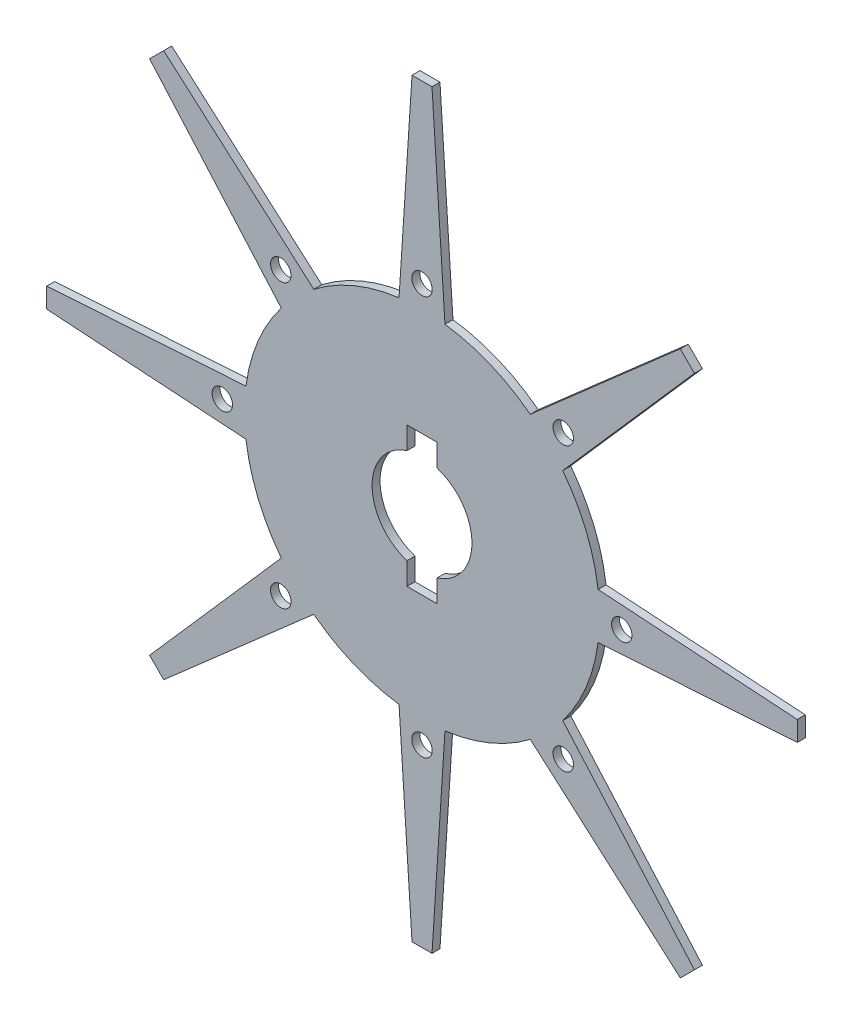
from build123d import *

# Parameters (mm, degrees)
BOSS_EXTRUDE1_DEPTH = 0.8
SKETCH2_R           = 1.025
CUT_EXTRUDE2_DEPTH  = 10


# Read off the part's stored shape, not the designer's step: Boss-Extrude1
with BuildPart() as part:
    # Boss-Extrude1 outline → Boss-Extrude1 (new body)
    with BuildSketch(Plane.XY):
        with BuildLine():
            ThreePointArc((-2.3, 17.630609746), (-6.804111427, 16.426578088), (-10.840378111, 14.093069304))
            Line((-10.840378111, 14.093069304), (-25.865044656, 27.279258218))
            Line((-25.865044656, 27.279258218), (-27.279258218, 25.865044656))
            Line((-27.279258218, 25.865044656), (-14.093069304, 10.840378111))
            ThreePointArc((-14.093069304, 10.840378111), (-16.426578088, 6.804111427), (-17.630609746, 2.3))
            Line((-17.630609746, 2.3), (-37.578696944, 1))
            Line((-37.578696944, 1), (-37.578696944, -1))
            Line((-37.578696944, -1), (-17.630609746, -2.3))
            ThreePointArc((-17.630609746, -2.3), (-16.426578088, -6.804111427), (-14.093069304, -10.840378111))
            Line((-14.093069304, -10.840378111), (-27.279258218, -25.865044656))
            Line((-27.279258218, -25.865044656), (-25.865044656, -27.279258218))
            Line((-25.865044656, -27.279258218), (-10.840378111, -14.093069304))
            ThreePointArc((-10.840378111, -14.093069304), (-6.804111427, -16.426578088), (-2.3, -17.630609746))
            Line((-2.3, -17.630609746), (-1, -37.578696944))
            Line((-1, -37.578696944), (1, -37.578696944))
            Line((1, -37.578696944), (2.3, -17.630609746))
            ThreePointArc((2.3, -17.630609746), (6.804111427, -16.426578088), (10.840378111, -14.093069304))
            Line((10.840378111, -14.093069304), (25.865044656, -27.279258218))
            Line((25.865044656, -27.279258218), (27.279258218, -25.865044656))
            Line((27.279258218, -25.865044656), (14.093069304, -10.840378111))
            ThreePointArc((14.093069304, -10.840378111), (16.426578088, -6.804111427), (17.630609746, -2.3))
            Line((17.630609746, -2.3), (37.578696944, -1))
            Line((37.578696944, -1), (37.578696944, 1))
            Line((37.578696944, 1), (17.630609746, 2.3))
            ThreePointArc((17.630609746, 2.3), (16.426578088, 6.804111427), (14.093069304, 10.840378111))
            Line((14.093069304, 10.840378111), (27.279258218, 25.865044656))
            Line((27.279258218, 25.865044656), (25.865044656, 27.279258218))
            Line((25.865044656, 27.279258218), (10.840378111, 14.093069304))
            ThreePointArc((10.840378111, 14.093069304), (6.804111427, 16.426578088), (2.3, 17.630609746))
            Line((2.3, 17.630609746), (1, 37.578696944))
            Line((1, 37.578696944), (-1, 37.578696944))
            Line((-1, 37.578696944), (-2.3, 17.630609746))
        make_face()
        with BuildLine():
            Line((-1.5, -7), (-1.5, -4.769696007))
            ThreePointArc((-1.5, -4.769696007), (-5, 0), (-1.5, 4.769696007))
            Line((-1.5, 4.769696007), (-1.5, 7))
            Line((-1.5, 7), (1.5, 7))
            Line((1.5, 7), (1.5, 4.769696007))
            ThreePointArc((1.5, 4.769696007), (5, 0), (1.5, -4.769696007))
            Line((1.5, -4.769696007), (1.5, -7))
            Line((1.5, -7), (-1.5, -7))
        make_face(mode=Mode.SUBTRACT)
    extrude(amount=BOSS_EXTRUDE1_DEPTH)

    # Sketch2 → Cut-Extrude2 (cut)
    with BuildSketch(Plane.XY):
        with Locations((0, 20)):
            Circle(SKETCH2_R)
        with Locations((14.142135624, 14.142135624)):
            Circle(SKETCH2_R)
        with Locations((20, 0)):
            Circle(SKETCH2_R)
        with Locations((14.142135624, -14.142135624)):
            Circle(SKETCH2_R)
        with Locations((0, -20)):
            Circle(SKETCH2_R)
        with Locations((-14.142135624, -14.142135624)):
            Circle(SKETCH2_R)
        with Locations((-20, 0)):
            Circle(SKETCH2_R)
        with Locations((-14.142135624, 14.142135624)):
            Circle(SKETCH2_R)
    extrude(amount=CUT_EXTRUDE2_DEPTH, mode=Mode.SUBTRACT)


solid = part.part
